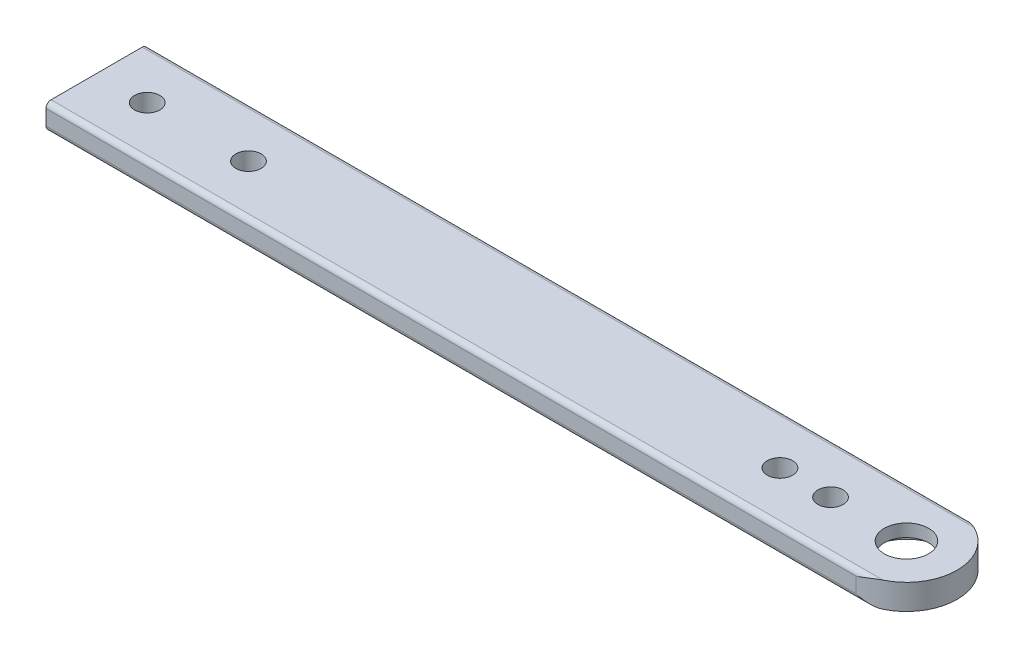
from build123d import *

# Parameters (mm, degrees)
SKETCH1_W           = 215.9
SKETCH1_H           = 25.4
BOSS_EXTRUDE1_DEPTH = 6.35
FILLET1_R           = 1.27
SKETCH2_R           = 3.175
SKETCH2_R_2         = 5.55625
CUT_EXTRUDE1_DEPTH  = 109.879819067
SKETCH3_R           = 9.525
CUT_EXTRUDE2_DEPTH  = 3.175
CUT_EXTRUDE3_DEPTH  = 109.879819067
SKETCH5_R           = 3.175
CUT_EXTRUDE4_DEPTH  = 109.879819183


with BuildPart() as part:
    # Sketch1 → Boss-Extrude1 (new body)
    with BuildSketch(Plane(origin=(0, 0, 0), x_dir=(1, 0, 0), z_dir=(0, 1, 0))):
        Rectangle(SKETCH1_W, SKETCH1_H)
    extrude(amount=BOSS_EXTRUDE1_DEPTH)

    # Fillet1
    fillet1_edges = [part.edges().sort_by_distance(p)[0] for p in [
        (0, 0, -12.7),
        (0, 6.35, -12.7),
        (0, 0, 12.7),
        (0, 6.35, 12.7),
    ]]
    fillet(fillet1_edges, radius=FILLET1_R)

    # Sketch2 → Cut-Extrude1 (cut, through all)
    with BuildSketch(Plane(origin=(0, 6.35, 0), x_dir=(1, 0, 0), z_dir=(0, 1, 0))):
        with Locations((-95.25, 0)):
            Circle(SKETCH2_R)
        with Locations((95.25, 0)):
            Circle(SKETCH2_R_2)
        with Locations((-69.85, 0)):
            Circle(SKETCH2_R)
    extrude(amount=-CUT_EXTRUDE1_DEPTH, mode=Mode.SUBTRACT)

    # Sketch3 → Cut-Extrude2 (cut)
    with BuildSketch(Plane.XZ):
        with Locations((95.25, 0)):
            Circle(SKETCH3_R)
    extrude(amount=-CUT_EXTRUDE2_DEPTH, mode=Mode.SUBTRACT)

    # Sketch4 → Cut-Extrude3 (cut, through all)
    with BuildSketch(Plane.XZ):
        with BuildLine():
            Line((95.250000011, -12.7), (107.95, -12.7))
            Line((107.95, -12.7), (107.95, 0))
            ThreePointArc((107.95, 0), (104.230256125, -8.980256117), (95.250000011, -12.7))
        make_face()
        with BuildLine():
            Line((107.95, 0), (107.95, 12.7))
            Line((107.95, 12.7), (95.249999989, 12.7))
            ThreePointArc((95.249999989, 12.7), (104.230256117, 8.980256125), (107.95, 0))
        make_face()
    extrude(amount=-CUT_EXTRUDE3_DEPTH, mode=Mode.SUBTRACT)

    # Sketch5 → Cut-Extrude4 (cut, through all)
    with BuildSketch(Plane.XZ):
        with Locations((76.2, 0)):
            Circle(SKETCH5_R)
        with Locations((63.5, 0)):
            Circle(SKETCH5_R)
    extrude(amount=-CUT_EXTRUDE4_DEPTH, mode=Mode.SUBTRACT)


solid = part.part
